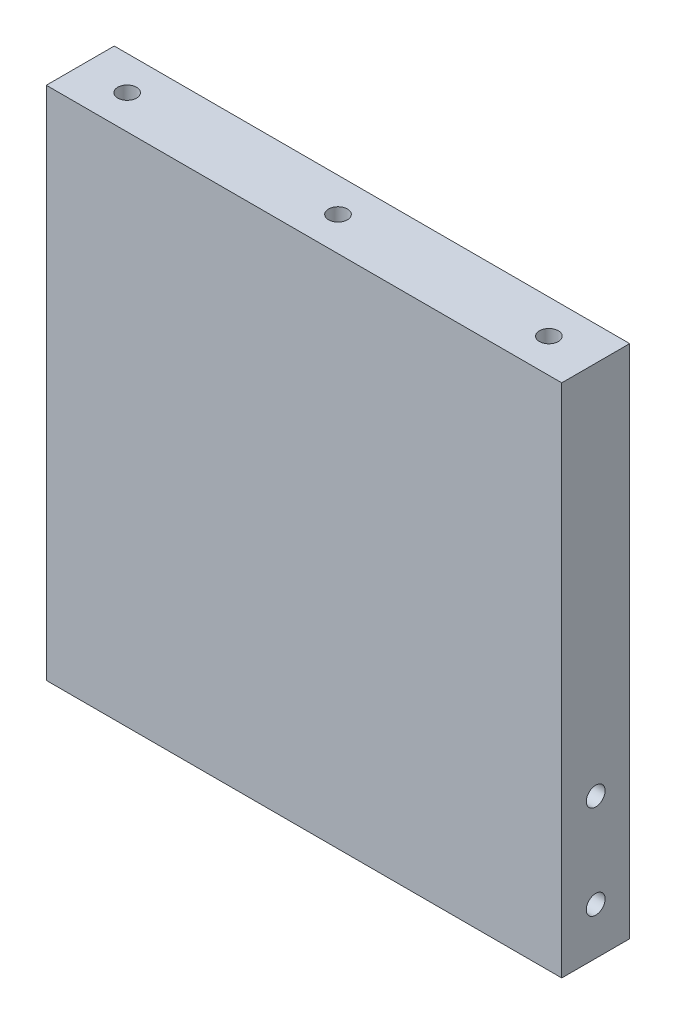
from build123d import *

# Parameters (mm, degrees)
SKETCH1_W           = 139.7
SKETCH1_H           = 18.415
BOSS_EXTRUDE1_DEPTH = 139.7


# Read off the part's stored shape, not the designer's step: Mirror2
with BuildPart() as part:
    # Sketch1 → Boss-Extrude1 (new body)
    with BuildSketch(Plane(origin=(0, 0, 0), x_dir=(1, 0, 0), z_dir=(0, 1, 0))):
        with Locations((69.85, 9.2075)):
            Rectangle(SKETCH1_W, SKETCH1_H)
    extrude(amount=BOSS_EXTRUDE1_DEPTH)

    # Sketch4 → 1/4-20 Tapped Hole1 (revolve, cut)
    with BuildSketch(Plane(origin=(139.7, 38.1, -9.2075), x_dir=(0, 0, -1), z_dir=(0, 1, 0))):
        Polygon((0, 0), (0, 20.583816902), (2.5527, 19.05), (2.5527, 0), align=None)
    revolve(axis=Axis((146.05, 38.1, -9.2075), (-1, 0, 0)), mode=Mode.SUBTRACT)

    # Sketch4 at point 2 (carried to point 2, square into its face) → 1/4-20 Tapped Hole1 at 2 (revolve, cut)
    with BuildSketch(Plane(origin=(139.7, 12.7, -9.2075), x_dir=(0, 0, -1), z_dir=(0, 1, 0))):
        Polygon((0, 0), (0, 20.583816902), (2.5527, 19.05), (2.5527, 0), align=None)
    revolve(axis=Axis((146.05, 12.7, -9.2075), (-1, 0, 0)), mode=Mode.SUBTRACT)

    # Sketch4 at point 3 (carried to point 3, square into its face) → 1/4-20 Tapped Hole1 at 3 (revolve, cut)
    with BuildSketch(Plane(origin=(69.85, 139.7, -9.2075), x_dir=(0, 0, -1), z_dir=(-1, 0, 0))):
        Polygon((0, 0), (0, 20.583816902), (2.5527, 19.05), (2.5527, 0), align=None)
    revolve(axis=Axis((69.85, 146.05, -9.2075), (0, -1, 0)), mode=Mode.SUBTRACT)

    # Sketch4 at point 4 (carried to point 4, square into its face) → 1/4-20 Tapped Hole1 at 4 (revolve, cut)
    with BuildSketch(Plane(origin=(12.7, 139.7, -9.2075), x_dir=(0, 0, -1), z_dir=(-1, 0, 0))):
        Polygon((0, 0), (0, 20.583816902), (2.5527, 19.05), (2.5527, 0), align=None)
    revolve(axis=Axis((12.7, 146.05, -9.2075), (0, -1, 0)), mode=Mode.SUBTRACT)

    # Mirror2 outline → Mirror2 (revolve, cut)
    with BuildSketch(Plane(origin=(0, 12.7, -9.2075), x_dir=(0, 1, 0), z_dir=(0, 0, -1))):
        Polygon((2.5527, 0), (2.5527, 19.05), (0, 20.583816902), (0, 0), align=None)
    revolve(axis=Axis((0, 12.7, -9.2075), (1, 0, 0)), mode=Mode.SUBTRACT)

    # Mirror2 2 outline → Mirror2 2 (revolve, cut)
    with BuildSketch(Plane(origin=(0, 38.1, -9.2075), x_dir=(0, 1, 0), z_dir=(0, 0, -1))):
        Polygon((2.5527, 0), (2.5527, 19.05), (0, 20.583816902), (0, 0), align=None)
    revolve(axis=Axis((0, 38.1, -9.2075), (1, 0, 0)), mode=Mode.SUBTRACT)

    # Mirror2 3 outline → Mirror2 3 (revolve, cut)
    with BuildSketch(Plane(origin=(127, 0, -9.2075), x_dir=(1, 0, 0), z_dir=(0, 0, 1))):
        Polygon((0, 139.7), (0, 119.116183098), (2.5527, 120.65), (2.5527, 139.7), align=None)
    revolve(axis=Axis((127, 0, -9.2075), (0, 1, 0)), mode=Mode.SUBTRACT)


solid = part.part
